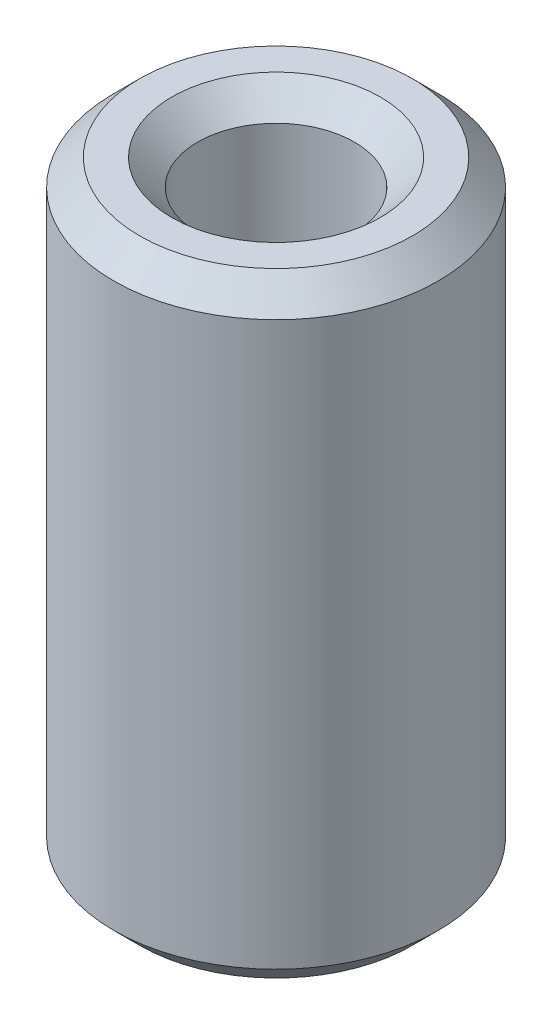
from build123d import *

# Parameters (mm, degrees)
SKETCH1_R           = 10
BOSS_EXTRUDE1_DEPTH = 37.866636519
SKETCH2_R           = 4.831907224
CUT_EXTRUDE1_DEPTH  = 41.421308258
CHAMFER1_SIZE       = 1.601084588


with BuildPart() as part:
    # Sketch1 → Boss-Extrude1 (new body)
    with BuildSketch(Plane(origin=(0, 0, 0), x_dir=(1, 0, 0), z_dir=(0, 1, 0))):
        Circle(SKETCH1_R)
    extrude(amount=BOSS_EXTRUDE1_DEPTH)

    # Sketch2 → Cut-Extrude1 (cut, through all)
    with BuildSketch(Plane(origin=(0, 0, 0), x_dir=(1, 0, 0), z_dir=(0, 1, 0))):
        Circle(SKETCH2_R)
    extrude(amount=CUT_EXTRUDE1_DEPTH, mode=Mode.SUBTRACT)

    # Chamfer1
    chamfer1_edges = [part.edges().sort_by_distance(p)[0] for p in [
        (-4.831907224, 37.866636519, 0),
        (-4.831907224, 0, 0),
        (-10, 0, 0),
        (-10, 37.866636519, 0),
    ]]
    chamfer(chamfer1_edges, length=CHAMFER1_SIZE)


solid = part.part
